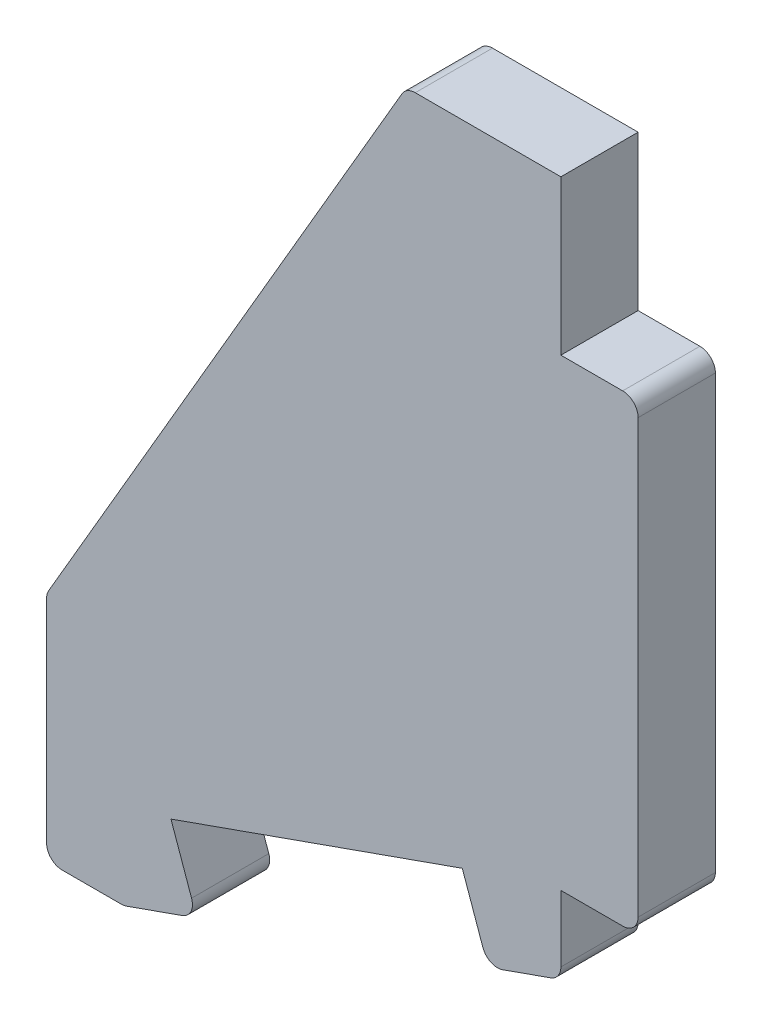
from build123d import *

# Parameters (mm, degrees)
BOSS_EXTRUDE1_DEPTH = 5
FILLET1_R           = 1


with BuildPart() as part:
    # Sketch1 → Boss-Extrude1 (new body)
    with BuildSketch(Plane.XY):
        Polygon((33.284271247, 15), (33.284271247, 45), (28.284271247, 45), (28.284271247, 55), (18.284271247, 55), (-5, 15), (-5, 0), (0, 0), (4.714045208, 1.666666667), (3.047378541, 6.380711875), (21.903559373, 13.047378541), (23.57022604, 8.333333333), (28.284271247, 10), (28.284271247, 15), align=None)
    extrude(amount=BOSS_EXTRUDE1_DEPTH)

    # Fillet1
    fillet1_edges = [part.edges().sort_by_distance(p)[0] for p in [
        (33.284271247, 45, 2.5),
        (33.284271247, 15, 2.5),
        (28.284271247, 10, 2.5),
        (23.57022604, 8.333333333, 2.5),
        (4.714045208, 1.666666667, 2.5),
        (0, 0, 2.5),
        (-5, 0, 2.5),
        (-5, 15, 2.5),
        (18.284271247, 55, 2.5),
    ]]
    fillet(fillet1_edges, radius=FILLET1_R)


solid = part.part
